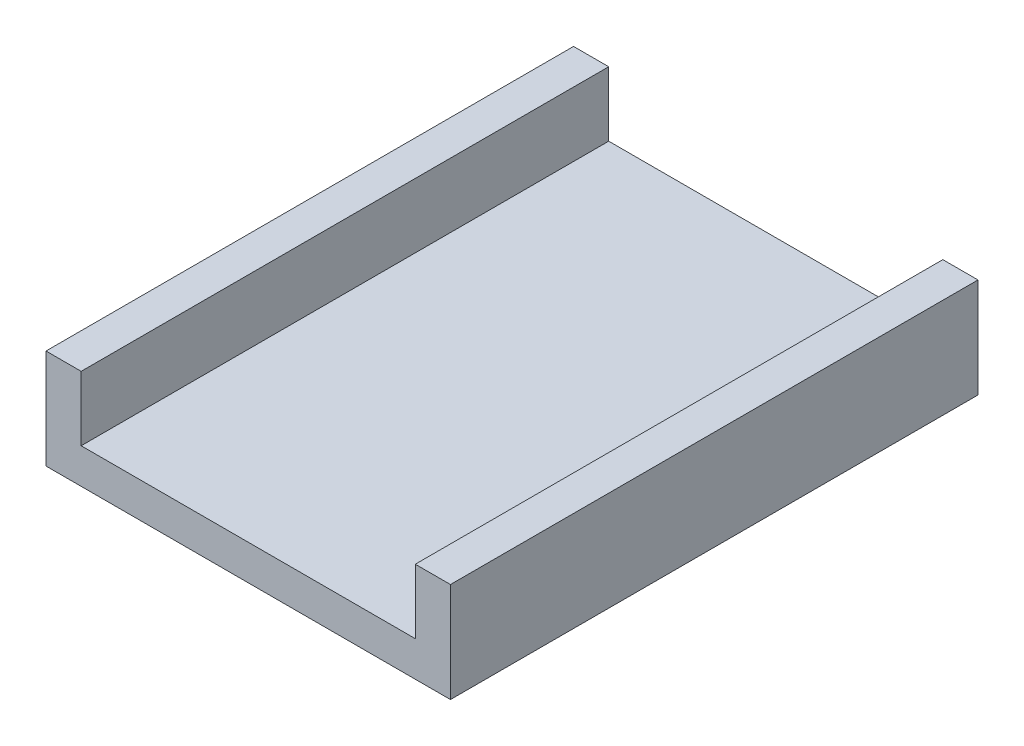
from build123d import *

# Parameters (mm, degrees)
SKETCH2_W           = 34.5
SKETCH2_H           = 45
BOSS_EXTRUDE1_DEPTH = 3
SKETCH3_W           = 3
SKETCH3_H           = 45
BOSS_EXTRUDE2_DEPTH = 5.5
SKETCH4_W           = 22
SKETCH4_H           = 7
CUT_EXTRUDE1_DEPTH  = 8
FILLET1_R           = 3.5
SKETCH5_W           = 34.5
SKETCH5_H           = 45
BOSS_EXTRUDE3_DEPTH = 3


with BuildPart() as part:
    # Sketch2 → Boss-Extrude1 (new body)
    with BuildSketch(Plane(origin=(0, 0, 0), x_dir=(1, 0, 0), z_dir=(0, 1, 0))):
        Rectangle(SKETCH2_W, SKETCH2_H)
    extrude(amount=BOSS_EXTRUDE1_DEPTH)

    # Sketch3 → Boss-Extrude2 (add)
    with BuildSketch(Plane(origin=(0, 3, 0), x_dir=(1, 0, 0), z_dir=(0, 1, 0))):
        with Locations((-15.75, 0)):
            Rectangle(SKETCH3_W, SKETCH3_H)
        with Locations((15.75, 0)):
            Rectangle(SKETCH3_W, SKETCH3_H)
    extrude(amount=BOSS_EXTRUDE2_DEPTH)

    # Sketch4 → Cut-Extrude1 (cut)
    with BuildSketch(Plane.XZ):
        with Locations((0, 13)):
            Rectangle(SKETCH4_W, SKETCH4_H)
        Rectangle(SKETCH4_W, SKETCH4_H)
        with Locations((0, -13)):
            Rectangle(SKETCH4_W, SKETCH4_H)
    extrude(amount=-CUT_EXTRUDE1_DEPTH, mode=Mode.SUBTRACT)

    # Fillet1
    fillet1_edges = [part.edges().sort_by_distance(p)[0] for p in [
        (-11, 1.5, -9.5),
        (-11, 1.5, -16.5),
        (11, 1.5, -9.5),
        (11, 1.5, -16.5),
        (11, 1.5, -3.5),
        (-11, 1.5, -3.5),
        (-11, 1.5, 3.5),
        (11, 1.5, 3.5),
        (11, 1.5, 9.5),
        (11, 1.5, 16.5),
        (-11, 1.5, 9.5),
        (-11, 1.5, 16.5),
    ]]
    fillet(fillet1_edges, radius=FILLET1_R - 0.0001)  # a hair under: the kernel refuses the full size

    # Sketch5 → Boss-Extrude3 (add)
    with BuildSketch(Plane.XZ):
        Rectangle(SKETCH5_W, SKETCH5_H)
    extrude(amount=-BOSS_EXTRUDE3_DEPTH)


solid = part.part
